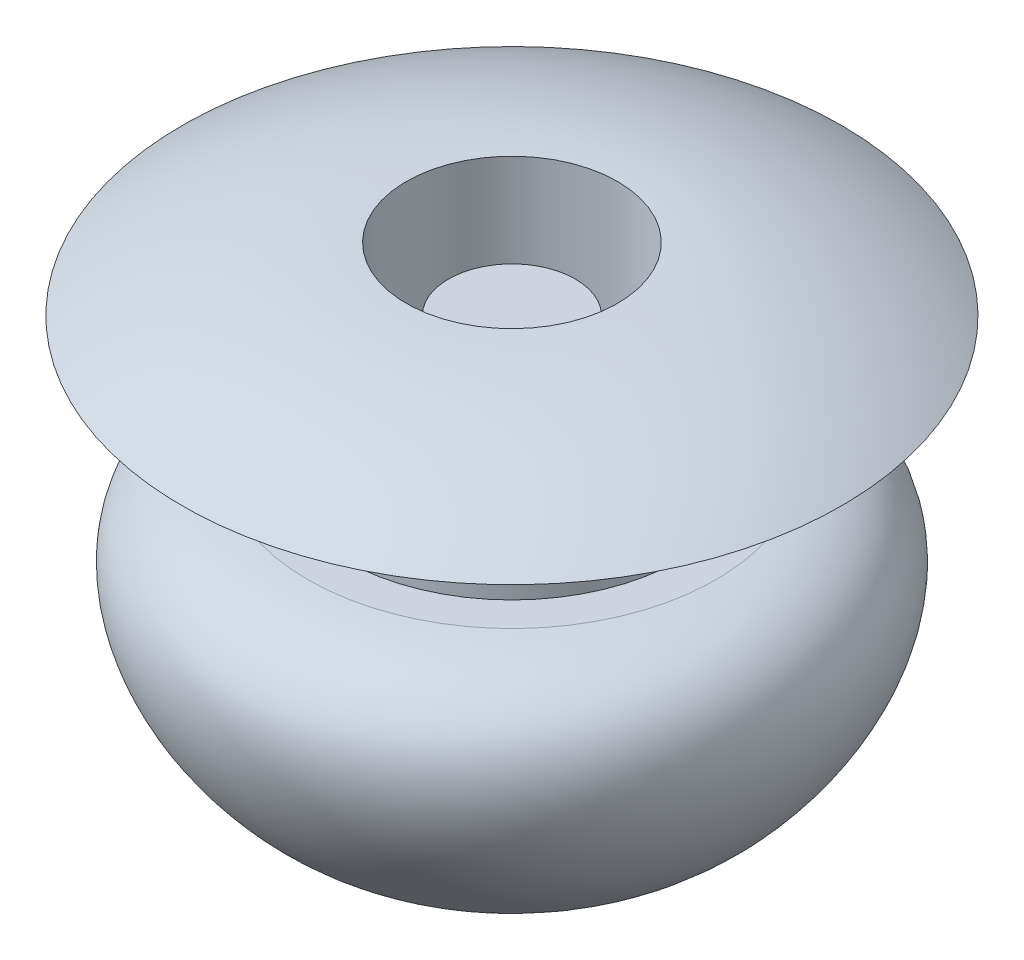
from build123d import *


with BuildPart() as part:
    # Szkic1 → Obrót1 (revolve)
    with BuildSketch(Plane(origin=(0, 0, 0), x_dir=(0, 0, -1), z_dir=(1, 0, 0))):
        with BuildLine():
            Line((0, 0), (-0.75, 0))
            Line((-0.75, 0), (-0.75, -1.700738523))
            Line((-0.75, -1.700738523), (-1.25, -1.700738523))
            Line((-1.25, -1.700738523), (-1.25, 0.75))
            ThreePointArc((-1.25, 0.75), (-2.627043935, 0.558888572), (-3.9, 0))
            Line((-3.9, 0), (-2, 0))
            Line((-2, 0), (-2, -1.5))
            Line((-2, -1.5), (-2.413891755, -1.5))
            add(Edge.make_bspline(
                [(-2.413891755, -1.5), (-3.867503112, -1.669657322), (-3.528877649, -3.802013626), (-1.083961642, -5.373532369), (-0.271752618, -3.374949298), (-0.956030427, -3.078929194)],
                knots=[0, 0, 0, 0, 0.464993082, 0.721927553, 1, 1, 1, 1], degree=3))
            add(Edge.make_bspline(
                [(-0.956030427, -3.078929194), (-0.520263876, -3.200738523), (0, -3.200738523)],
                knots=[4.134444875, 4.134444875, 4.134444875, 4.71238898, 4.71238898, 4.71238898], degree=2, weights=[1, 0.958537313, 1]))
            Line((0, -3.200738523), (0, -1.700738523))
            Line((0, -1.700738523), (0, 0))
        make_face()
    revolve(axis=Axis((0, 0, 0), (0, 1, 0)))


solid = part.part
